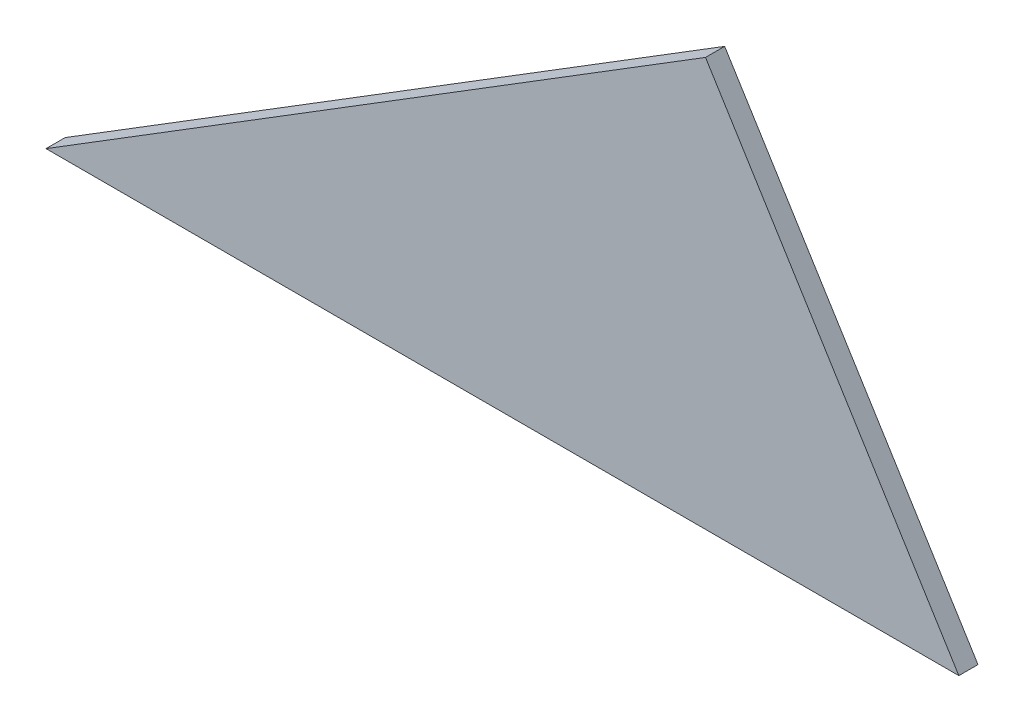
from build123d import *

# Parameters (mm, degrees)
BASE_FLANGE1_DEPTH = 2


# Sheet-metal steps are written as plain solids
with BuildPart() as part:
    # Sketch1 → Base-Flange1 (new body)
    with BuildSketch(Plane.XY):
        Polygon((0, 0), (68.854379434, 42.674371655), (95.30298025, 0), align=None)
    extrude(amount=-BASE_FLANGE1_DEPTH)


solid = part.part
